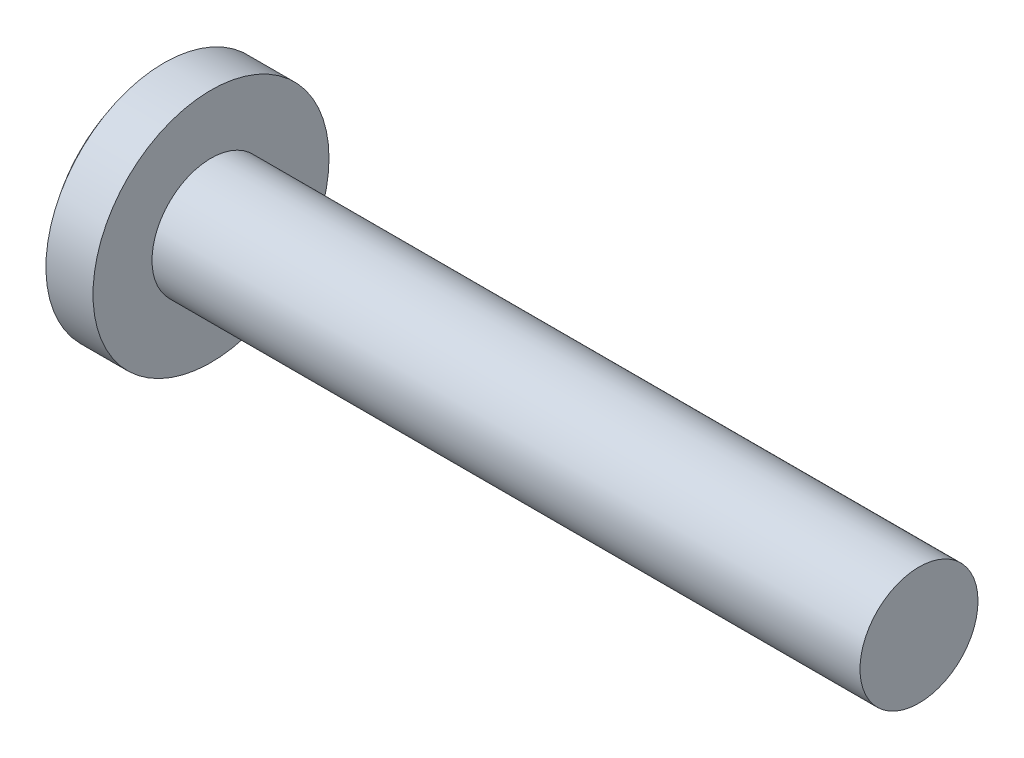
from build123d import *

# Parameters (mm, degrees)
CUT_EXTRUDE2_DEPTH = 1.3
FILLET5_R          = 0.3
DRAFT2_ANGLE       = -30


with BuildPart() as part:
    # Sketch1 → Base (revolve)
    with BuildSketch(Plane.XY):
        with BuildLine():
            Line((67.5, 5), (10.5, 5))
            Line((10.5, 5), (7.5, 5))
            Line((7.5, 5), (7.5, 5.6))
            Line((7.5, 5.6), (7.5, 10))
            Line((7.5, 10), (3.510004003, 10))
            ThreePointArc((3.510004003, 10), (0.902981487, 5.299059542), (0, 0))
            Line((0, 0), (67.5, 0))
            Line((67.5, 0), (67.5, 5))
        make_face()
    revolve(axis=Axis((4.515812911, 0, 0), (-1, 0, 0)))

    # Sketch6 → Cut-Extrude2 (cut)
    with BuildSketch(Plane(origin=(0, 0, 0), x_dir=(0, 0, -1), z_dir=(1, 0, 0))):
        Polygon((1.01, 1.01), (1.01, 5.05), (-1.01, 5.05), (-1.01, 1.01), (-5.05, 1.01), (-5.05, -1.01), (-1.01, -1.01), (-1.01, -5.05), (1.01, -5.05), (1.01, -1.01), (5.05, -1.01), (5.05, 1.01), align=None)
    extrude(amount=CUT_EXTRUDE2_DEPTH, mode=Mode.SUBTRACT)

    # Fillet5
    fillet5_edges = [part.edges().sort_by_distance(p)[0] for p in [
        (0.681941893, -1.01, 1.01),
        (0.681941893, -1.01, -1.01),
        (0.681941893, 1.01, 1.01),
        (0.681941893, 1.01, -1.01),
    ]]
    fillet(fillet5_edges, radius=FILLET5_R)

    # Draft2
    draft2_faces = [part.faces().sort_by_distance(p)[0] for p in [
        (1.064424177, 0, 5.05),
        (1.064424177, 5.05, 0),
        (1.064424177, -5.05, 0),
        (1.064424177, 0, -5.05),
    ]]
    draft(draft2_faces, Plane(origin=(0, 0, 0), x_dir=(0, 0, 1), z_dir=(1, 0, 0)), DRAFT2_ANGLE)


solid = part.part
